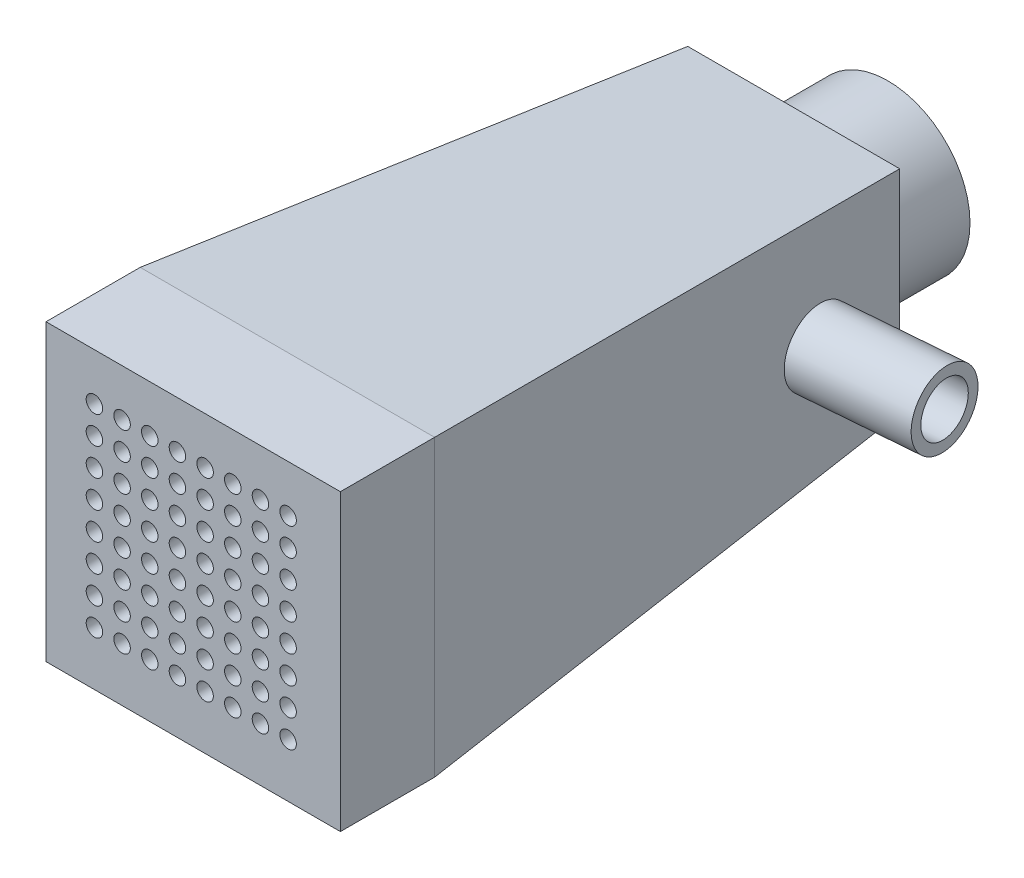
from build123d import *

# Parameters (mm, degrees)
SKETCH2_4_W         = 25
SKETCH2_4_H         = 25
BOSS_EXTRUDE2_DEPTH = 8
SKETCH5_R           = 0.7
CUT_EXTRUDE1_DEPTH  = 8
SKETCH6_R           = 3.1
SKETCH6_R_2         = 2.3
BOSS_EXTRUDE4_DEPTH = 10
CUT_EXTRUDE2_START  = -4
SKETCH6_4_R         = 2.3
CUT_EXTRUDE2_DEPTH  = 4
SKETCH9_R           = 3.1
SKETCH9_R_2         = 2.2
BOSS_EXTRUDE5_DEPTH = 10
SKETCH1_7_R         = 6.969369829
SKETCH1_7_R_2       = 4.88
BOSS_EXTRUDE7_DEPTH = 8
CUT_EXTRUDE3_START  = -20
SKETCH10_R          = 2.2
CUT_EXTRUDE3_DEPTH  = 20


with BuildPart() as part:
    # Sketch1 → Loft1 section 0
    with BuildSketch(Plane.XY):
        with BuildLine():
            Line((-9, 9), (9, 9))
            Line((9, 9), (9, -9))
            Line((9, -9), (-9, -9))
            Line((-9, -9), (-9, 9))
        make_face()
    # Sketch2 → Loft1 section 1
    with BuildSketch(Plane.XY.offset(43)):
        with BuildLine():
            Line((-12.5, 12.5), (12.5, 12.5))
            Line((12.5, 12.5), (12.5, -12.5))
            Line((12.5, -12.5), (-12.5, -12.5))
            Line((-12.5, -12.5), (-12.5, 12.5))
        make_face()
    loft()

    # Cut-Loft1: read off the stored shape, not the designer's step
    # Cut-Loft1: loft between two sections, ruled curve by curve
    cut_loft1_from = [
        Edge.make_bspline([(-3.450681092, -3.450681092, 0), (-3.044014426, -3.857347759, 0), (-2.531155679, -4.22197395, 0), (-1.641760344, -4.606883572, 0), (-1.326204919, -4.708150629, 0), (-0.673711552, -4.84475124, 0), (-0.336893697, -4.88, 0), (0.336893697, -4.88, 0), (0.673711552, -4.84475124, 0), (1.326204919, -4.708150629, 0), (1.641760344, -4.606883572, 0), (2.531155679, -4.22197395, 0), (3.044014426, -3.857347759, 0), (3.450681092, -3.450681092, 0)], [0, 0, 0, 0, 0.25, 0.25, 0.375, 0.375, 0.5, 0.5, 0.625, 0.625, 0.75, 0.75, 1, 1, 1, 1], 3),
        Edge.make_bspline([(3.450681092, -3.450681092, 0), (3.857347759, -3.044014426, 0), (4.22197395, -2.531155679, 0), (4.606883572, -1.641760344, 0), (4.708150629, -1.326204919, 0), (4.84475124, -0.673711552, 0), (4.88, -0.336893697, 0), (4.88, 0.336893697, 0), (4.84475124, 0.673711552, 0), (4.708150629, 1.326204919, 0), (4.606883572, 1.641760344, 0), (4.22197395, 2.531155679, 0), (3.857347759, 3.044014426, 0), (3.450681092, 3.450681092, 0)], [0, 0, 0, 0, 0.25, 0.25, 0.375, 0.375, 0.5, 0.5, 0.625, 0.625, 0.75, 0.75, 1, 1, 1, 1], 3),
        Edge.make_bspline([(-3.450681092, 3.450681092, 0), (-3.857347759, 3.044014426, 0), (-4.22197395, 2.531155679, 0), (-4.606883572, 1.641760344, 0), (-4.708150629, 1.326204919, 0), (-4.84475124, 0.673711552, 0), (-4.88, 0.336893697, 0), (-4.88, -0.336893697, 0), (-4.84475124, -0.673711552, 0), (-4.708150629, -1.326204919, 0), (-4.606883572, -1.641760344, 0), (-4.22197395, -2.531155679, 0), (-3.857347759, -3.044014426, 0), (-3.450681092, -3.450681092, 0)], [0, 0, 0, 0, 0.25, 0.25, 0.375, 0.375, 0.5, 0.5, 0.625, 0.625, 0.75, 0.75, 1, 1, 1, 1], 3),
        Edge.make_bspline([(3.450681092, 3.450681092, 0), (3.044014426, 3.857347759, 0), (2.531155679, 4.22197395, 0), (1.641760344, 4.606883572, 0), (1.326204919, 4.708150629, 0), (0.673711552, 4.84475124, 0), (0.336893697, 4.88, 0), (-0.336893697, 4.88, 0), (-0.673711552, 4.84475124, 0), (-1.326204919, 4.708150629, 0), (-1.641760344, 4.606883572, 0), (-2.531155679, 4.22197395, 0), (-3.044014426, 3.857347759, 0), (-3.450681092, 3.450681092, 0)], [0, 0, 0, 0, 0.25, 0.25, 0.375, 0.375, 0.5, 0.5, 0.625, 0.625, 0.75, 0.75, 1, 1, 1, 1], 3),
    ]
    cut_loft1_to = [
        Edge.make_bspline([(-10, -10, 43), (-8.333333333, -10, 43), (-6.666666667, -10, 43), (-4.166666667, -10, 43), (-3.333333333, -10, 43), (-1.666666667, -10, 43), (-0.833333333, -10, 43), (0.833333333, -10, 43), (1.666666667, -10, 43), (3.333333333, -10, 43), (4.166666667, -10, 43), (6.666666667, -10, 43), (8.333333333, -10, 43), (10, -10, 43)], [0, 0, 0, 0, 0.25, 0.25, 0.375, 0.375, 0.5, 0.5, 0.625, 0.625, 0.75, 0.75, 1, 1, 1, 1], 3),
        Edge.make_bspline([(10, -10, 43), (10, -8.333333333, 43), (10, -6.666666667, 43), (10, -4.166666667, 43), (10, -3.333333333, 43), (10, -1.666666667, 43), (10, -0.833333333, 43), (10, 0.833333333, 43), (10, 1.666666667, 43), (10, 3.333333333, 43), (10, 4.166666667, 43), (10, 6.666666667, 43), (10, 8.333333333, 43), (10, 10, 43)], [0, 0, 0, 0, 0.25, 0.25, 0.375, 0.375, 0.5, 0.5, 0.625, 0.625, 0.75, 0.75, 1, 1, 1, 1], 3),
        Edge.make_bspline([(-10, 10, 43), (-10, 8.333333333, 43), (-10, 6.666666667, 43), (-10, 4.166666667, 43), (-10, 3.333333333, 43), (-10, 1.666666667, 43), (-10, 0.833333333, 43), (-10, -0.833333333, 43), (-10, -1.666666667, 43), (-10, -3.333333333, 43), (-10, -4.166666667, 43), (-10, -6.666666667, 43), (-10, -8.333333333, 43), (-10, -10, 43)], [0, 0, 0, 0, 0.25, 0.25, 0.375, 0.375, 0.5, 0.5, 0.625, 0.625, 0.75, 0.75, 1, 1, 1, 1], 3),
        Edge.make_bspline([(10, 10, 43), (8.333333333, 10, 43), (6.666666667, 10, 43), (4.166666667, 10, 43), (3.333333333, 10, 43), (1.666666667, 10, 43), (0.833333333, 10, 43), (-0.833333333, 10, 43), (-1.666666667, 10, 43), (-3.333333333, 10, 43), (-4.166666667, 10, 43), (-6.666666667, 10, 43), (-8.333333333, 10, 43), (-10, 10, 43)], [0, 0, 0, 0, 0.25, 0.25, 0.375, 0.375, 0.5, 0.5, 0.625, 0.625, 0.75, 0.75, 1, 1, 1, 1], 3),
    ]
    cut_loft1 = Solid(Shell([*[Face.make_surface_from_curves(cut_loft1_from[k], cut_loft1_to[k]) for k in range(4)], Face(Wire(cut_loft1_from)), Face(Wire(cut_loft1_to))]))
    add(cut_loft1, mode=Mode.SUBTRACT)

    # Sketch2<4> → Boss-Extrude2 (add)
    with BuildSketch(Plane.XY.offset(43)):
        Rectangle(SKETCH2_4_W, SKETCH2_4_H)
    extrude(amount=BOSS_EXTRUDE2_DEPTH)

    # Sketch5 → Cut-Extrude1 (cut)
    with BuildSketch(Plane.XY.offset(43)):
        with Locations((-8.388056057, 8.509622087)):
            Circle(SKETCH5_R)
        with Locations((-6.038056057, 8.509622087)):
            Circle(SKETCH5_R)
        with Locations((-3.688056057, 8.509622087)):
            Circle(SKETCH5_R)
        with Locations((-1.338056057, 8.509622087)):
            Circle(SKETCH5_R)
        with Locations((1.011943943, 8.509622087)):
            Circle(SKETCH5_R)
        with Locations((3.361943943, 8.509622087)):
            Circle(SKETCH5_R)
        with Locations((5.711943943, 8.509622087)):
            Circle(SKETCH5_R)
        with Locations((8.061943943, 8.509622087)):
            Circle(SKETCH5_R)
        with Locations((-6.038056057, 6.159622087)):
            Circle(SKETCH5_R)
        with Locations((-3.688056057, 6.159622087)):
            Circle(SKETCH5_R)
        with Locations((-1.338056057, 6.159622087)):
            Circle(SKETCH5_R)
        with Locations((1.011943943, 6.159622087)):
            Circle(SKETCH5_R)
        with Locations((3.361943943, 6.159622087)):
            Circle(SKETCH5_R)
        with Locations((5.711943943, 6.159622087)):
            Circle(SKETCH5_R)
        with Locations((8.061943943, 6.159622087)):
            Circle(SKETCH5_R)
        with Locations((-6.038056057, 3.809622087)):
            Circle(SKETCH5_R)
        with Locations((-3.688056057, 3.809622087)):
            Circle(SKETCH5_R)
        with Locations((-1.338056057, 3.809622087)):
            Circle(SKETCH5_R)
        with Locations((1.011943943, 3.809622087)):
            Circle(SKETCH5_R)
        with Locations((3.361943943, 3.809622087)):
            Circle(SKETCH5_R)
        with Locations((5.711943943, 3.809622087)):
            Circle(SKETCH5_R)
        with Locations((8.061943943, 3.809622087)):
            Circle(SKETCH5_R)
        with Locations((-6.038056057, 1.459622087)):
            Circle(SKETCH5_R)
        with Locations((-3.688056057, 1.459622087)):
            Circle(SKETCH5_R)
        with Locations((-1.338056057, 1.459622087)):
            Circle(SKETCH5_R)
        with Locations((1.011943943, 1.459622087)):
            Circle(SKETCH5_R)
        with Locations((3.361943943, 1.459622087)):
            Circle(SKETCH5_R)
        with Locations((5.711943943, 1.459622087)):
            Circle(SKETCH5_R)
        with Locations((8.061943943, 1.459622087)):
            Circle(SKETCH5_R)
        with Locations((-6.038056057, -0.890377913)):
            Circle(SKETCH5_R)
        with Locations((-3.688056057, -0.890377913)):
            Circle(SKETCH5_R)
        with Locations((-1.338056057, -0.890377913)):
            Circle(SKETCH5_R)
        with Locations((1.011943943, -0.890377913)):
            Circle(SKETCH5_R)
        with Locations((3.361943943, -0.890377913)):
            Circle(SKETCH5_R)
        with Locations((5.711943943, -0.890377913)):
            Circle(SKETCH5_R)
        with Locations((8.061943943, -0.890377913)):
            Circle(SKETCH5_R)
        with Locations((-6.038056057, -3.240377913)):
            Circle(SKETCH5_R)
        with Locations((-3.688056057, -3.240377913)):
            Circle(SKETCH5_R)
        with Locations((-1.338056057, -3.240377913)):
            Circle(SKETCH5_R)
        with Locations((1.011943943, -3.240377913)):
            Circle(SKETCH5_R)
        with Locations((3.361943943, -3.240377913)):
            Circle(SKETCH5_R)
        with Locations((5.711943943, -3.240377913)):
            Circle(SKETCH5_R)
        with Locations((8.061943943, -3.240377913)):
            Circle(SKETCH5_R)
        with Locations((-6.038056057, -5.590377913)):
            Circle(SKETCH5_R)
        with Locations((-3.688056057, -5.590377913)):
            Circle(SKETCH5_R)
        with Locations((-1.338056057, -5.590377913)):
            Circle(SKETCH5_R)
        with Locations((1.011943943, -5.590377913)):
            Circle(SKETCH5_R)
        with Locations((3.361943943, -5.590377913)):
            Circle(SKETCH5_R)
        with Locations((5.711943943, -5.590377913)):
            Circle(SKETCH5_R)
        with Locations((8.061943943, -5.590377913)):
            Circle(SKETCH5_R)
        with Locations((-6.038056057, -7.940377913)):
            Circle(SKETCH5_R)
        with Locations((-3.688056057, -7.940377913)):
            Circle(SKETCH5_R)
        with Locations((-1.338056057, -7.940377913)):
            Circle(SKETCH5_R)
        with Locations((1.011943943, -7.940377913)):
            Circle(SKETCH5_R)
        with Locations((3.361943943, -7.940377913)):
            Circle(SKETCH5_R)
        with Locations((5.711943943, -7.940377913)):
            Circle(SKETCH5_R)
        with Locations((8.061943943, -7.940377913)):
            Circle(SKETCH5_R)
        with Locations((-8.388056057, 6.159622087)):
            Circle(SKETCH5_R)
        with Locations((-8.388056057, 3.809622087)):
            Circle(SKETCH5_R)
        with Locations((-8.388056057, 1.459622087)):
            Circle(SKETCH5_R)
        with Locations((-8.388056057, -0.890377913)):
            Circle(SKETCH5_R)
        with Locations((-8.388056057, -3.240377913)):
            Circle(SKETCH5_R)
        with Locations((-8.388056057, -5.590377913)):
            Circle(SKETCH5_R)
        with Locations((-8.388056057, -7.940377913)):
            Circle(SKETCH5_R)
    extrude(amount=CUT_EXTRUDE1_DEPTH, mode=Mode.SUBTRACT)

    # Sketch6 → Boss-Extrude4 (add)
    with BuildSketch(Plane(origin=(-8.940765615, 0, -0.727736736), x_dir=(-0.08112705090276601, 0, 0.9967037682339824), z_dir=(-0.9967037682339824, 0, -0.08112705090276602))):
        with Locations(Location((34.477535136, -1.520969622, 0), (0, 0, 180))):
            Circle(SKETCH6_R)
        with Locations((34.477535136, -1.520969622)):
            Circle(SKETCH6_R_2, mode=Mode.SUBTRACT)
    extrude(amount=BOSS_EXTRUDE4_DEPTH)

    # Sketch6<4> → Cut-Extrude2 (cut)
    with BuildSketch(Plane(origin=(-8.940765615, 0, -0.727736736), x_dir=(-0.08112705090276601, 0, 0.9967037682339824), z_dir=(-0.9967037682339824, 0, -0.08112705090276602)).offset(CUT_EXTRUDE2_START)):
        with Locations((34.477535136, -1.520969622)):
            Circle(SKETCH6_4_R)
    extrude(amount=CUT_EXTRUDE2_DEPTH, mode=Mode.SUBTRACT)

    # Sketch9 → Boss-Extrude5 (add)
    with BuildSketch(Plane(origin=(8.940765615, 0, -0.727736736), x_dir=(-0.08112705090276603, 0, -0.9967037682339824), z_dir=(0.9967037682339824, 0, -0.08112705090276605))):
        with Locations((-8.341303969, 0)):
            Circle(SKETCH9_R)
        with Locations((-8.341303969, 0)):
            Circle(SKETCH9_R_2, mode=Mode.SUBTRACT)
    extrude(amount=BOSS_EXTRUDE5_DEPTH)

    # Sketch1<7> → Boss-Extrude7 (add)
    with BuildSketch(Plane.XY):
        Circle(SKETCH1_7_R)
        Circle(SKETCH1_7_R_2, mode=Mode.SUBTRACT)
    extrude(amount=-BOSS_EXTRUDE7_DEPTH)

    # Sketch10 → Cut-Extrude3 (cut)
    with BuildSketch(Plane(origin=(18.907803297, 0, -1.539007245), x_dir=(-0.08112705090276605, 0, -0.9967037682339824), z_dir=(0.9967037682339824, 0, -0.08112705090276606)).offset(CUT_EXTRUDE3_START)):
        with Locations((-8.341303969, 0)):
            Circle(SKETCH10_R)
    extrude(amount=CUT_EXTRUDE3_DEPTH, mode=Mode.SUBTRACT)


solid = part.part
